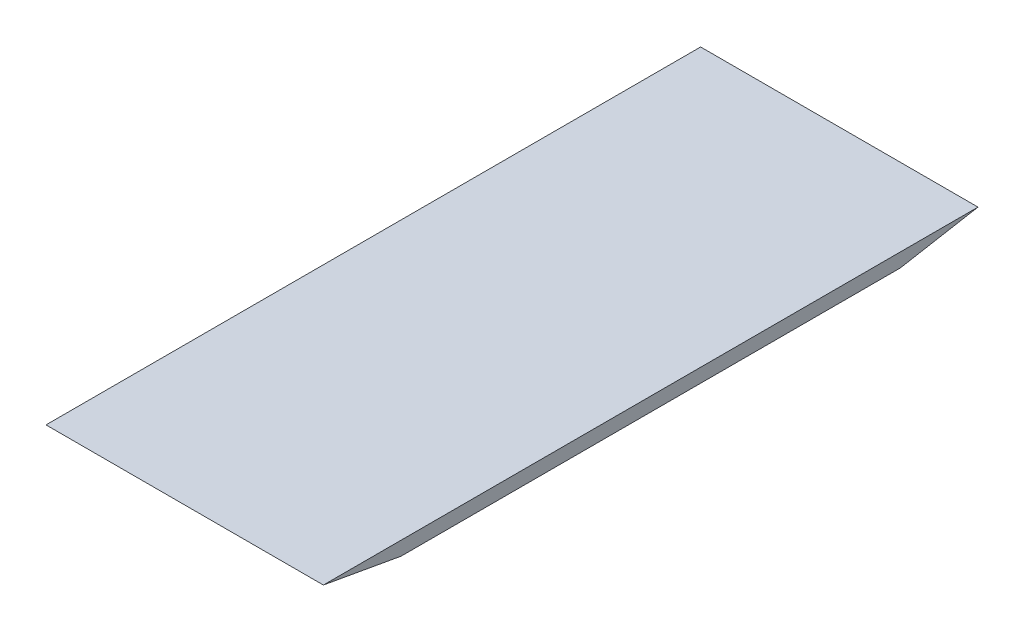
from build123d import *

# Parameters (mm, degrees)
BOSS_EXTRUDE1_DEPTH = 100


with BuildPart() as part:
    # Sketch1 → Boss-Extrude1 (new body)
    with BuildSketch(Plane(origin=(0, 0, 0), x_dir=(0, 0, -1), z_dir=(1, 0, 0))):
        Polygon((0, 0), (236, 0), (208, -5), (28, -5), align=None)
    extrude(amount=BOSS_EXTRUDE1_DEPTH)


solid = part.part
